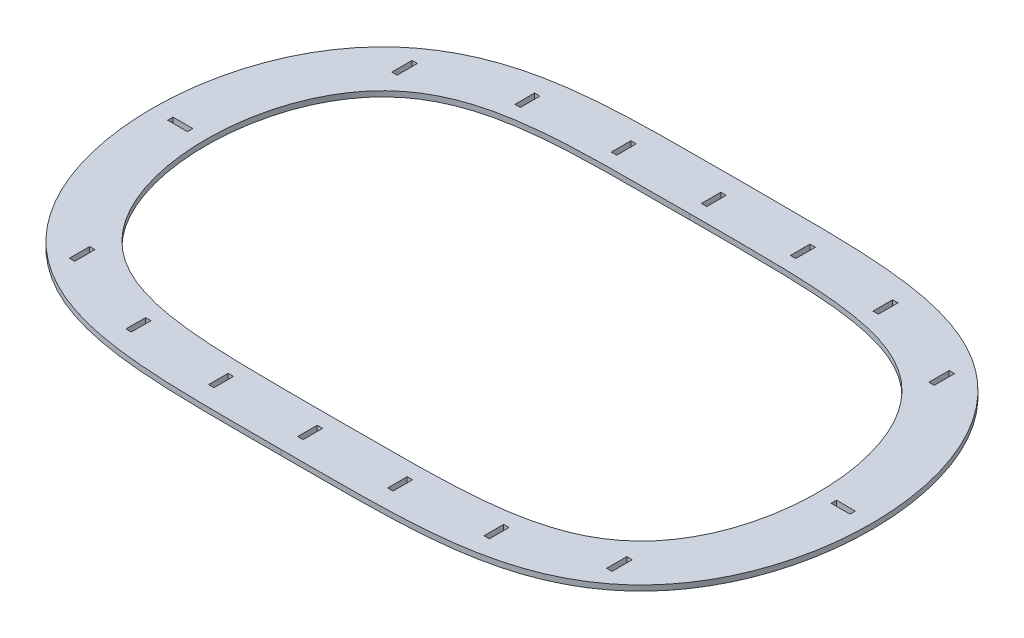
from build123d import *

# Parameters (mm, degrees)
BODY_DEPTH         = 3
CUT_INSIDE_DEPTH   = 50
SKETCH7_W          = 3
SKETCH7_H          = 11.325502538
SKETCH7_H_2        = 10.969520129
SKETCH7_H_3        = 10.913687771
SKETCH7_H_4        = 10.9101963
SKETCH7_W_2        = 10.563281837
SKETCH7_H_5        = 3
SKETCH7_H_6        = 10.910196299
SKETCH7_H_7        = 10.969520128
SKETCH7_W_3        = 11.126563704
CUT_EXTRUDE1_DEPTH = 239.787145488


with BuildPart() as part:
    # Sketch1 → body (new body)
    with BuildSketch(Plane(origin=(0, 0, 0), x_dir=(1, 0, 0), z_dir=(0, 1, 0))):
        with BuildLine():
            add(Edge.make_bspline(
                [(0, 129.099444874), (4.329825716, 129.099856757), (12.989477034, 129.099521717), (25.976301205, 129.099245615), (43.290249676, 129.013980379), (60.600663959, 128.671189087), (77.894655735, 127.812916551), (95.543037977, 126.045988358), (113.01399335, 122.896019952), (130.046357946, 117.797143556), (146.158139311, 110.226946457), (160.431314667, 100.265018203), (172.693338202, 87.911885541), (182.663351285, 73.663423027), (190.340438043, 58.079107996), (195.865426103, 41.62272021), (199.400795759, 24.636185909), (201.069948812, 7.370686111), (200.935166589, -9.973525735), (198.991239132, -27.210718658), (195.166319776, -44.135428769), (189.328734448, -60.48538478), (181.314677982, -75.901802403), (170.994375318, -89.90233662), (157.866189481, -102.437720294), (141.967900724, -112.68294779), (124.642016349, -119.756709815), (106.708377896, -124.219228333), (88.446200884, -126.903428265), (70.051310284, -128.322663007), (45.62975056, -129.099776243), (25.349069661, -129.099346893), (10.139933531, -129.099445048), (-2.223e-06, -129.099444874)],
                knots=[0, 0, 0, 0, 0, 0.03122023, 0.062440461, 0.093641547, 0.124842633, 0.156052703, 0.187262773, 0.221451125, 0.252661674, 0.283871788, 0.315081907, 0.34629216, 0.377502474, 0.408712793, 0.439923128, 0.471133499, 0.502343874, 0.533554233, 0.564764591, 0.595974957, 0.627185296, 0.658395569, 0.689605838, 0.720816286, 0.757370802, 0.793925658, 0.823852077, 0.853778496, 0.890332223, 0.92688595, 1, 1, 1, 1, 1], degree=4))
            add(Edge.make_bspline(
                [(0, 129.099444874), (-4.329825716, 129.099856832), (-12.989477034, 129.099521941), (-25.976301205, 129.099246062), (-43.290249678, 129.013981124), (-60.600663967, 128.67119013), (-77.894655757, 127.812917893), (-95.543038029, 126.045990003), (-113.013993457, 122.896021898), (-130.04635814, 117.797145795), (-146.158139636, 110.226948973), (-160.431315164, 100.265020966), (-172.693338911, 87.911888514), (-182.663352239, 73.663426172), (-190.340439266, 58.079111273), (-195.865427609, 41.622723582), (-199.400797558, 24.636189342), (-201.069950908, 7.370689573), (-200.935168983, -9.973522276), (-198.991241823, -27.210715232), (-195.166322759, -44.135425409), (-189.328737713, -60.48538152), (-181.314681512, -75.901799281), (-170.994379089, -89.902333676), (-157.866193468, -102.437717576), (-141.967904887, -112.682945345), (-124.642020634, -119.756707669), (-106.708382258, -124.219226496), (-88.446205291, -126.903426743), (-70.051314717, -128.322661801), (-45.629755005, -129.099775457), (-25.349074106, -129.099346457), (-10.139937977, -129.099444874), (-2.223e-06, -129.099444874)],
                knots=[0, 0, 0, 0, 0, 0.03122023, 0.062440461, 0.093641547, 0.124842633, 0.156052703, 0.187262773, 0.221451125, 0.252661674, 0.283871788, 0.315081907, 0.34629216, 0.377502474, 0.408712793, 0.439923128, 0.471133499, 0.502343874, 0.533554233, 0.564764591, 0.595974957, 0.627185296, 0.658395569, 0.689605838, 0.720816286, 0.757370802, 0.793925658, 0.823852077, 0.853778496, 0.890332223, 0.92688595, 1, 1, 1, 1, 1], degree=4))
        make_face()
    extrude(amount=BODY_DEPTH)

    # Sketch6 → cut-inside (cut)
    with BuildSketch(Plane(origin=(0, 3, 0), x_dir=(1, 0, 0), z_dir=(0, 1, 0))):
        with BuildLine():
            add(Edge.make_bspline(
                [(-1.706e-06, -99.099444874), (4.796310554, -99.099444956), (9.592626984, -99.10000195), (19.185217445, -99.095452084), (23.981491685, -99.090373073), (33.573841551, -99.053682079), (38.369917642, -99.022132332), (47.961599661, -98.896223734), (52.757942544, -98.801978653), (62.346668013, -98.496182152), (67.133591101, -98.284990185), (76.682804597, -97.669595658), (81.445138122, -97.265730948), (90.931585037, -96.158525757), (95.655803311, -95.45600711), (102.698898177, -94.063478378), (105.039342127, -93.542460404), (108.536595349, -92.655837544), (109.700103602, -92.342722848), (112.022139549, -91.677468054), (113.181651353, -91.324934182), (118.924628295, -89.468007915), (123.37470726, -87.674506756), (129.764272253, -84.3748475), (131.846503077, -83.173325015), (134.889851922, -81.200316647), (135.893990208, -80.511868541), (137.853569241, -79.090265343), (138.810050934, -78.356706371), (143.477080307, -74.576257283), (146.840688798, -71.190621496), (150.618570925, -66.542023785), (151.352826978, -65.591487384), (152.779676323, -63.649735755), (153.47330002, -62.65699035), (155.486308643, -59.629227454), (156.725272369, -57.564739694), (160.169609974, -51.24965822), (162.10536169, -46.878754355), (164.560375817, -40.122219352), (165.303267983, -37.83637574), (166.310844769, -34.359971482), (166.629065174, -33.192230281), (167.226835042, -30.856733418), (167.506952657, -29.687143215), (168.817757437, -23.830381124), (169.581557742, -19.117017718), (170.599868705, -9.640310667), (170.853948754, -4.876924764), (170.858640841, 2.305095664), (170.79710567, 4.705294849), (170.607546129, 8.315138132), (170.528009174, 9.520831222), (170.337082883, 11.920893042), (170.225628463, 13.116992873), (169.588313139, 19.07781528), (168.824301051, 23.783993983), (166.755081961, 33.06331133), (165.450667884, 37.636644897), (163.019259231, 44.379929883), (162.129108619, 46.608103828), (160.659277537, 49.917275227), (160.145553645, 51.017335116), (159.077970232, 53.189384205), (158.524047875, 54.261815085), (155.650247867, 59.553614092), (153.020633466, 63.563825661), (149.240054661, 68.243302326), (148.459112887, 69.162433347), (146.845104901, 70.965497215), (146.00939579, 71.851957399), (143.447485136, 74.429014375), (141.663411404, 76.041651896), (136.0871113, 80.569345115), (132.069770494, 83.172747869), (126.707769529, 85.955848604), (125.615586669, 86.490295392), (123.417638235, 87.505688622), (122.311154412, 87.987223175), (118.971061676, 89.359916523), (116.716843071, 90.179274999), (109.884969342, 92.396208166), (105.238859439, 93.555299203), (98.174161342, 94.9611158), (95.803181116, 95.373698626), (91.03459072, 96.106090526), (88.646452062, 96.424440905), (81.480991459, 97.262972359), (76.698563151, 97.668492179), (67.126812691, 98.285527095), (62.337472601, 98.496537388), (52.754651531, 98.802026149), (47.961161515, 98.896250342), (38.371957167, 99.022102567), (33.576238537, 99.053609687), (23.983866157, 99.090308027), (19.18721059, 99.095448086), (9.593703868, 99.100224055), (4.796854173, 99.099901048), (-2.58e-07, 99.099444738)],
                knots=[0, 0, 0, 0, 0.03125, 0.03125, 0.0625, 0.0625, 0.09375, 0.09375, 0.125, 0.125, 0.15625, 0.15625, 0.1875, 0.1875, 0.21875, 0.21875, 0.234375, 0.234375, 0.2421875, 0.2421875, 0.25, 0.25, 0.28125, 0.28125, 0.296875, 0.296875, 0.3046875, 0.3046875, 0.3125, 0.3125, 0.34375, 0.34375, 0.3515625, 0.3515625, 0.359375, 0.359375, 0.375, 0.375, 0.40625, 0.40625, 0.421875, 0.421875, 0.4296875, 0.4296875, 0.4375, 0.4375, 0.46875, 0.46875, 0.5, 0.5, 0.515625, 0.515625, 0.5234375, 0.5234375, 0.53125, 0.53125, 0.5625, 0.5625, 0.59375, 0.59375, 0.609375, 0.609375, 0.6171875, 0.6171875, 0.625, 0.625, 0.65625, 0.65625, 0.6640625, 0.6640625, 0.671875, 0.671875, 0.6875, 0.6875, 0.71875, 0.71875, 0.7265625, 0.7265625, 0.734375, 0.734375, 0.75, 0.75, 0.78125, 0.78125, 0.796875, 0.796875, 0.8125, 0.8125, 0.84375, 0.84375, 0.875, 0.875, 0.90625, 0.90625, 0.9375, 0.9375, 0.96875, 0.96875, 1, 1, 1, 1], degree=3))
            add(Edge.make_bspline(
                [(-2.58e-07, 99.099444738), (-4.796405433, 99.099901088), (-9.59280961, 99.100224071), (-19.185577403, 99.095449823), (-23.981940717, 99.090312254), (-33.574469663, 99.053620587), (-38.3706357, 99.022120608), (-47.962497172, 98.896233616), (-52.758933989, 98.801951105), (-62.347828063, 98.496147716), (-67.134842293, 98.284967356), (-76.684237054, 97.669460333), (-81.446665881, 97.265512343), (-90.933346225, 96.158278209), (-95.657711752, 95.455885984), (-102.701004236, 94.06314034), (-105.041497431, 93.541882071), (-108.538850483, 92.655032794), (-109.702398804, 92.341884249), (-112.024531166, 91.676663556), (-113.184031854, 91.324216935), (-118.926837066, 89.467623589), (-123.376415491, 87.673358892), (-129.766119896, 84.373952686), (-131.848396428, 83.172429024), (-134.891740334, 81.199120966), (-135.895845929, 80.510564283), (-137.855174593, 79.088954728), (-138.811562869, 78.355405957), (-143.47826719, 74.575059234), (-146.841750003, 71.189356251), (-150.619734624, 66.540604924), (-151.354025183, 65.590035332), (-152.780908859, 63.648151861), (-153.474584788, 62.655208833), (-155.487305306, 59.627509686), (-156.726158944, 57.563060001), (-160.170409325, 51.248092738), (-162.106056422, 46.877100687), (-164.561045145, 40.120313467), (-165.303910661, 37.834347614), (-166.311459387, 34.357722792), (-166.629647192, 33.189993559), (-167.227349383, 30.85458015), (-167.507440135, 29.685026484), (-168.81812286, 23.82842017), (-169.581843997, 19.115094008), (-170.600013492, 9.638303628), (-170.854027807, 4.874796678), (-170.858606726, -2.307524628), (-170.797027469, -4.707844492), (-170.607382724, -8.317901124), (-170.527820973, -9.523558957), (-170.336853646, -11.923498562), (-170.225379643, -13.119544617), (-169.587969747, -19.080134513), (-168.82388537, -23.786240904), (-166.754491428, -33.065646543), (-165.449890282, -37.639119626), (-163.018144648, -44.382810904), (-162.127857368, -46.611149693), (-160.657735577, -49.920607105), (-160.143913378, -51.020739039), (-159.076341986, -53.19256072), (-158.522437559, -54.26490405), (-155.648694899, -59.556337289), (-153.018760893, -63.566307268), (-149.237846303, -68.245969093), (-148.456813877, -69.165143643), (-146.842551879, -70.968292448), (-146.006722495, -71.854739441), (-143.444948633, -74.431327099), (-141.661001878, -76.043836518), (-136.084774797, -80.571117939), (-132.066998419, -83.174109428), (-126.704630503, -85.957546345), (-125.612381148, -86.492055419), (-123.414579666, -87.50728383), (-122.308133484, -87.988660862), (-118.968105608, -89.360850549), (-116.713919434, -90.180016853), (-109.882239411, -92.397164944), (-105.235945093, -93.555912203), (-98.170885869, -94.961548938), (-95.799786859, -95.374183321), (-91.030888487, -96.106609036), (-88.643104762, -96.424891427), (-81.477977641, -97.263330908), (-76.695753912, -97.668734274), (-67.124395212, -98.285607699), (-62.335243721, -98.496614133), (-52.752787099, -98.80207357), (-47.959472259, -98.896254093), (-38.370615404, -99.022119356), (-33.575068758, -99.053674157), (-23.983034135, -99.09036944), (-19.186544044, -99.095450639), (-9.593363899, -99.100001924), (-4.796672877, -99.099444874), (-1.706e-06, -99.099444874)],
                knots=[0, 0, 0, 0, 0.03125, 0.03125, 0.0625, 0.0625, 0.09375, 0.09375, 0.125, 0.125, 0.15625, 0.15625, 0.1875, 0.1875, 0.21875, 0.21875, 0.234375, 0.234375, 0.2421875, 0.2421875, 0.25, 0.25, 0.28125, 0.28125, 0.296875, 0.296875, 0.3046875, 0.3046875, 0.3125, 0.3125, 0.34375, 0.34375, 0.3515625, 0.3515625, 0.359375, 0.359375, 0.375, 0.375, 0.40625, 0.40625, 0.421875, 0.421875, 0.4296875, 0.4296875, 0.4375, 0.4375, 0.46875, 0.46875, 0.5, 0.5, 0.515625, 0.515625, 0.5234375, 0.5234375, 0.53125, 0.53125, 0.5625, 0.5625, 0.59375, 0.59375, 0.609375, 0.609375, 0.6171875, 0.6171875, 0.625, 0.625, 0.65625, 0.65625, 0.6640625, 0.6640625, 0.671875, 0.671875, 0.6875, 0.6875, 0.71875, 0.71875, 0.7265625, 0.7265625, 0.734375, 0.734375, 0.75, 0.75, 0.78125, 0.78125, 0.796875, 0.796875, 0.8125, 0.8125, 0.84375, 0.84375, 0.875, 0.875, 0.90625, 0.90625, 0.9375, 0.9375, 0.96875, 0.96875, 1, 1, 1, 1], degree=3))
        make_face()
    extrude(amount=-CUT_INSIDE_DEPTH, mode=Mode.SUBTRACT)

    # Sketch7 → Cut-Extrude1 (cut, through all)
    with BuildSketch(Plane(origin=(0, 3, 0), x_dir=(1, 0, 0), z_dir=(0, 1, 0))):
        with Locations((-149.999999907, 90.024862548)):
            Rectangle(SKETCH7_W, SKETCH7_H)
        with Locations((-99.999999907, 108.623473401)):
            Rectangle(SKETCH7_W, SKETCH7_H_2)
        with Locations((-49.999999907, 112.481274281)):
            Rectangle(SKETCH7_W, SKETCH7_H_3)
        with Locations((0, 112.734150425)):
            Rectangle(SKETCH7_W, SKETCH7_H_4)
        with Locations((49.999999551, 112.481274281)):
            Rectangle(SKETCH7_W, SKETCH7_H_3)
        with Locations((100.000000049, 108.623473399)):
            Rectangle(SKETCH7_W, SKETCH7_H_2)
        with Locations((150.000000049, 90.024862549)):
            Rectangle(SKETCH7_W, SKETCH7_H)
        with Locations((185.012181984, -2e-09)):
            Rectangle(SKETCH7_W_2, SKETCH7_H_5)
        with Locations((150.000000049, -90.024862553)):
            Rectangle(SKETCH7_W, SKETCH7_H)
        with Locations((100.000000049, -108.623473406)):
            Rectangle(SKETCH7_W, SKETCH7_H_2)
        with Locations((49.999999551, -112.481274282)):
            Rectangle(SKETCH7_W, SKETCH7_H_3)
        with Locations((0, -112.734150426)):
            Rectangle(SKETCH7_W, SKETCH7_H_6)
        with Locations((-49.999999907, -112.481274282)):
            Rectangle(SKETCH7_W, SKETCH7_H_3)
        with Locations((-99.999999907, -108.623473404)):
            Rectangle(SKETCH7_W, SKETCH7_H_7)
        with Locations((-149.999999907, -90.024862554)):
            Rectangle(SKETCH7_W, SKETCH7_H)
        with Locations((-185.293822757, -2e-09)):
            Rectangle(SKETCH7_W_3, SKETCH7_H_5)
    extrude(amount=-CUT_EXTRUDE1_DEPTH, mode=Mode.SUBTRACT)


solid = part.part
